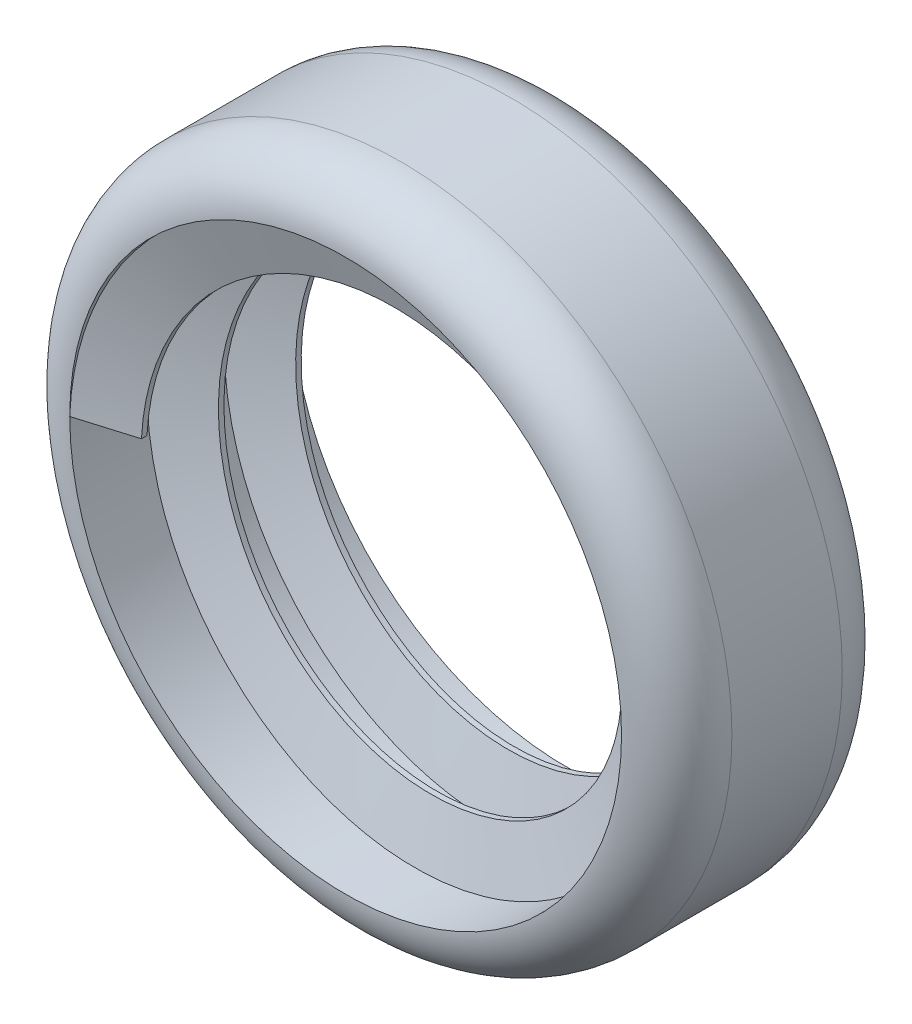
from build123d import *

# Parameters (mm, degrees)
SZKIC1_R                      = 6
SZKIC1_R_2                    = 5
DODANIE_WYCI_GNI_CIE1_DEPTH   = 4
WYCI_GNI_CIE_PO_CIE_CE2_PITCH = 1.4
SZKIC10_W                     = 16.369764177
SZKIC10_H                     = 8.133619779
SZKIC10_W_2                   = 12
SZKIC10_H_2                   = 4
WYTNIJ_WYCI_GNI_CIE3_DEPTH    = 15
ZAOKR_GLENIE1_R               = 1


with BuildPart() as part:
    # Szkic1 → Dodanie-wyciągnięcie1 (new body)
    with BuildSketch(Plane.XY):
        Circle(SZKIC1_R)
        Circle(SZKIC1_R_2, mode=Mode.SUBTRACT)
    extrude(amount=DODANIE_WYCI_GNI_CIE1_DEPTH)

    # Wyciągnięcie po ścieżce2: the profile of Szkic8 profile screwed along a right-hand helix of 2.5 turns, 8 arcs to a turn; built about Z, then put on its axis
    wyci_gni_cie_po_cie_ce2_z = Axis((0, 0, 0), (0, 0, 1))
    wyci_gni_cie_po_cie_ce2_corners = [(5.0003, 0, 0.70009), (5.0003, 0, -9e-05), (4, 0, 0.3), (4, 0, 0.4)]
    with BuildLine(mode=Mode.PRIVATE) as wyci_gni_cie_po_cie_ce2_profile:
        Line(wyci_gni_cie_po_cie_ce2_corners[0], wyci_gni_cie_po_cie_ce2_corners[1])
        Line(wyci_gni_cie_po_cie_ce2_corners[1], wyci_gni_cie_po_cie_ce2_corners[2])
        Line(wyci_gni_cie_po_cie_ce2_corners[2], wyci_gni_cie_po_cie_ce2_corners[3])
        Line(wyci_gni_cie_po_cie_ce2_corners[3], wyci_gni_cie_po_cie_ce2_corners[0])
    wyci_gni_cie_po_cie_ce2_cap = Face(wyci_gni_cie_po_cie_ce2_profile.wire())
    wyci_gni_cie_po_cie_ce2_turn_angles = [0, 22.5, 45, 67.5, 90, 112.5, 135, 157.5, 180, 202.5, 225, 247.5, 270, 292.5, 315, 337.5, 360]
    wyci_gni_cie_po_cie_ce2_turn_weights = [1, 0.9238795325112867, 1, 0.9238795325112867, 1, 0.9238795325112867, 1, 0.9238795325112867, 1, 0.9238795325112867, 1, 0.9238795325112867, 1, 0.9238795325112867, 1, 0.9238795325112867, 1]
    wyci_gni_cie_po_cie_ce2_turn_rails = [Edge.make_bspline([Vector(p[0], p[1], 0).rotate(wyci_gni_cie_po_cie_ce2_z, wyci_gni_cie_po_cie_ce2_turn_angles[k]) / wyci_gni_cie_po_cie_ce2_turn_weights[k] + Vector(0, 0, p[2] + WYCI_GNI_CIE_PO_CIE_CE2_PITCH * wyci_gni_cie_po_cie_ce2_turn_angles[k] / 360) for k in range(17)], [0, 0, 0, 1, 1, 2, 2, 3, 3, 4, 4, 5, 5, 6, 6, 7, 7, 8, 8, 8], 2, wyci_gni_cie_po_cie_ce2_turn_weights) for p in wyci_gni_cie_po_cie_ce2_corners]
    wyci_gni_cie_po_cie_ce2_turn_sides = [Face.make_surface_from_curves(wyci_gni_cie_po_cie_ce2_turn_rails[p[0]], wyci_gni_cie_po_cie_ce2_turn_rails[p[1]]) for p in [(0, 1), (1, 2), (2, 3), (3, 0)]]
    wyci_gni_cie_po_cie_ce2_last_angles = [720, 742.5, 765, 787.5, 810, 832.5, 855, 877.5, 900]
    wyci_gni_cie_po_cie_ce2_last_weights = [1, 0.9238795325112867, 1, 0.9238795325112867, 1, 0.9238795325112867, 1, 0.9238795325112795, 1]
    wyci_gni_cie_po_cie_ce2_last_rails = [Edge.make_bspline([Vector(p[0], p[1], 0).rotate(wyci_gni_cie_po_cie_ce2_z, wyci_gni_cie_po_cie_ce2_last_angles[k]) / wyci_gni_cie_po_cie_ce2_last_weights[k] + Vector(0, 0, p[2] + WYCI_GNI_CIE_PO_CIE_CE2_PITCH * wyci_gni_cie_po_cie_ce2_last_angles[k] / 360) for k in range(9)], [0, 0, 0, 1, 1, 2, 2, 3, 3, 4, 4, 4], 2, wyci_gni_cie_po_cie_ce2_last_weights) for p in wyci_gni_cie_po_cie_ce2_corners]
    wyci_gni_cie_po_cie_ce2_last_sides = [Face.make_surface_from_curves(wyci_gni_cie_po_cie_ce2_last_rails[p[0]], wyci_gni_cie_po_cie_ce2_last_rails[p[1]]) for p in [(0, 1), (1, 2), (2, 3), (3, 0)]]
    wyci_gni_cie_po_cie_ce2 = Plane(origin=(0, 0, 4), x_dir=(-1, 0, 0), z_dir=(0, 0, -1)) * Solid(Shell([*[p.moved(Location((0, 0, WYCI_GNI_CIE_PO_CIE_CE2_PITCH * i))) for i in range(2) for p in wyci_gni_cie_po_cie_ce2_turn_sides], *wyci_gni_cie_po_cie_ce2_last_sides, wyci_gni_cie_po_cie_ce2_cap, wyci_gni_cie_po_cie_ce2_cap.rotate(wyci_gni_cie_po_cie_ce2_z, 900).moved(Location((0, 0, WYCI_GNI_CIE_PO_CIE_CE2_PITCH * 900 / 360)))]))
    add(wyci_gni_cie_po_cie_ce2)

    # Szkic10 → Wytnij-wyciągnięcie3 (cut)
    with BuildSketch(Plane(origin=(0, 6, 0), x_dir=(1, 0, 0), z_dir=(0, 1, 0))):
        with Locations((-0.154286879, -2.230248785)):
            Rectangle(SZKIC10_W, SZKIC10_H)
        with Locations((0, -2)):
            Rectangle(SZKIC10_W_2, SZKIC10_H_2, mode=Mode.SUBTRACT)
    extrude(amount=-WYTNIJ_WYCI_GNI_CIE3_DEPTH, mode=Mode.SUBTRACT)

    # Zaokrąglenie1
    zaokr_glenie1_edges = [part.edges().sort_by_distance(p)[0] for p in [
        (-6, 0, 0),
        (-6, 0, 4),
    ]]
    fillet(zaokr_glenie1_edges, radius=ZAOKR_GLENIE1_R - 0.0001)  # a hair under: the kernel refuses the full size


solid = part.part
